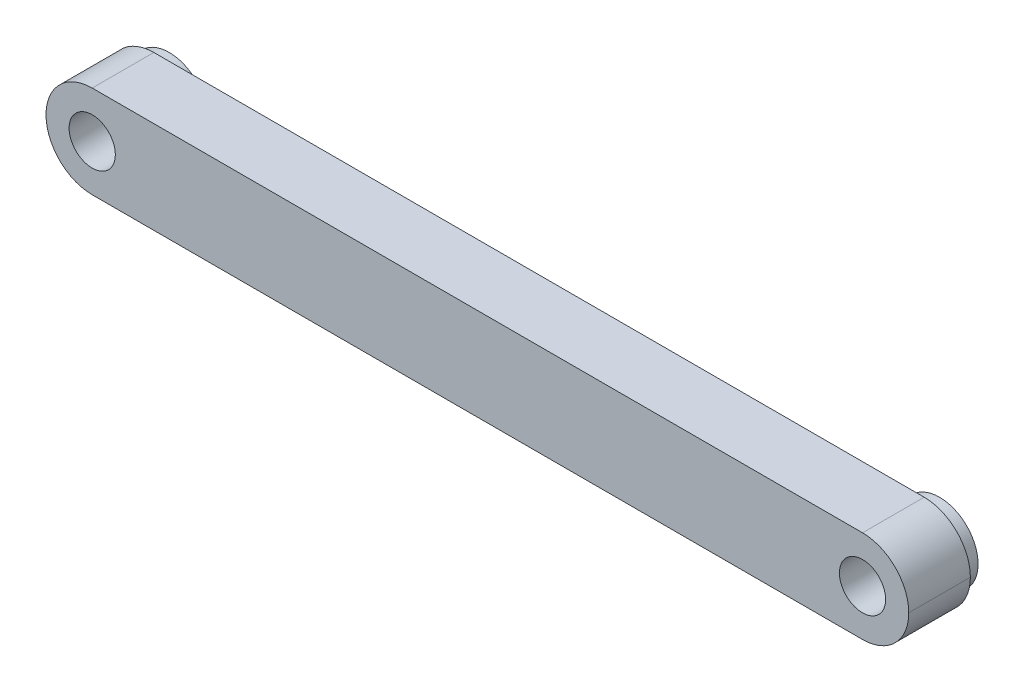
from build123d import *

# Parameters (mm, degrees)
SKETCH_1_W      = 56
SKETCH_1_H      = 6
SKETCH_1_R      = 1.5
EXTRUDE_1_DEPTH = 4
FILLET_1_R      = 3
EXTRUDE_START   = 1
SKETCH_2_R      = 2.5
SKETCH_2_R_2    = 1.5
EXTRUDE_2_DEPTH = 1


with BuildPart() as part:
    # 草图1 → 凸台-拉伸1 (new body)
    with BuildSketch(Plane.XY):
        Rectangle(SKETCH_1_W, SKETCH_1_H)
        with Locations((-25, 0)):
            Circle(SKETCH_1_R, mode=Mode.SUBTRACT)
        with Locations((25, 0)):
            Circle(SKETCH_1_R, mode=Mode.SUBTRACT)
    extrude(amount=EXTRUDE_1_DEPTH)

    # 圆角1
    fillet_1_edges = [part.edges().sort_by_distance(p)[0] for p in [
        (28, -3, 2),
        (28, 3, 2),
        (-28, -3, 2),
        (-28, 3, 2),
    ]]
    fillet(fillet_1_edges, radius=FILLET_1_R - 0.0001)  # a hair under: the kernel refuses the full size

    # 草图2 → 凸台-拉伸2 (add)
    # profile 1 of 2: a face of its own
    with BuildSketch(Plane(origin=(0, 0, 0), x_dir=(-1, 0, 0), z_dir=(0, 0, -1)).offset(EXTRUDE_START)):
        with Locations((25, 0)):
            Circle(SKETCH_2_R)
        with Locations((25, 0)):
            Circle(SKETCH_2_R_2, mode=Mode.SUBTRACT)
    # profile 2 of 2: a face of its own
    with BuildSketch(Plane(origin=(0, 0, 0), x_dir=(-1, 0, 0), z_dir=(0, 0, -1)).offset(EXTRUDE_START)):
        with Locations((-25, 0)):
            Circle(SKETCH_2_R)
        with Locations((-25, 0)):
            Circle(SKETCH_2_R_2, mode=Mode.SUBTRACT)
    extrude(amount=-EXTRUDE_2_DEPTH)


solid = part.part
